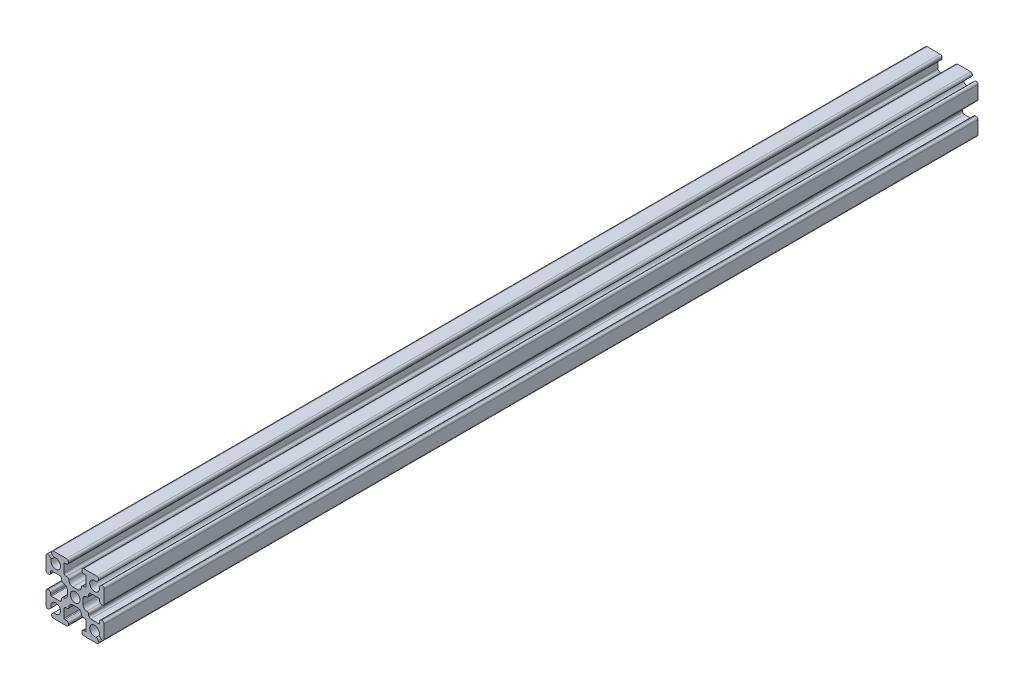
from build123d import *

# Parameters (mm, degrees)
SKETCH1_R           = 1.25
BOSS_EXTRUDE1_DEPTH = 225


with BuildPart() as part:
    # Sketch1 → Boss-Extrude1 (new body)
    with BuildSketch(Plane(origin=(0, 0, 0), x_dir=(-1, 0, 0), z_dir=(0, 0, -1))):
        with BuildLine():
            Line((6.646446609, 5.939339828), (6.163645978, 5.456539197))
            ThreePointArc((6.163645978, 5.456539197), (4.116116524, 4.116116524), (5.456539197, 6.163645978))
            Line((5.456539197, 6.163645978), (5.939339828, 6.646446609))
            ThreePointArc((5.939339828, 6.646446609), (6.047726204, 7.191341716), (5.585786438, 7.5))
            Line((5.585786438, 7.5), (2.25, 7.5))
            ThreePointArc((2.25, 7.5), (1.896446609, 7.353553391), (1.75, 7))
            Line((1.75, 7), (1.75, 6.8))
            ThreePointArc((1.75, 6.8), (1.896446609, 6.446446609), (2.25, 6.3))
            Line((2.25, 6.3), (2.65, 6.3))
            ThreePointArc((2.65, 6.3), (2.791421356, 6.241421356), (2.85, 6.1))
            Line((2.85, 6.1), (2.85, 4))
            ThreePointArc((2.85, 4), (2.703553391, 3.646446609), (2.35, 3.5))
            Line((2.35, 3.5), (2.1, 3.5))
            ThreePointArc((2.1, 3.5), (1.746446609, 3.353553391), (1.6, 3))
            ThreePointArc((1.6, 3), (1.307106781, 2.292893219), (0.6, 2))
            Line((0.6, 2), (-0.6, 2))
            ThreePointArc((-0.6, 2), (-1.307106781, 2.292893219), (-1.6, 3))
            ThreePointArc((-1.6, 3), (-1.746446609, 3.353553391), (-2.1, 3.5))
            Line((-2.1, 3.5), (-2.35, 3.5))
            ThreePointArc((-2.35, 3.5), (-2.703553391, 3.646446609), (-2.85, 4))
            Line((-2.85, 4), (-2.85, 6.1))
            ThreePointArc((-2.85, 6.1), (-2.791421356, 6.241421356), (-2.65, 6.3))
            Line((-2.65, 6.3), (-2.25, 6.3))
            ThreePointArc((-2.25, 6.3), (-1.896446609, 6.446446609), (-1.75, 6.8))
            Line((-1.75, 6.8), (-1.75, 7))
            ThreePointArc((-1.75, 7), (-1.896446609, 7.353553391), (-2.25, 7.5))
            Line((-2.25, 7.5), (-5.585786438, 7.5))
            ThreePointArc((-5.585786438, 7.5), (-6.047726204, 7.191341716), (-5.939339828, 6.646446609))
            Line((-5.939339828, 6.646446609), (-5.456539197, 6.163645978))
            ThreePointArc((-5.456539197, 6.163645978), (-4.116116524, 4.116116524), (-6.163645978, 5.456539197))
            Line((-6.163645978, 5.456539197), (-6.646446609, 5.939339828))
            ThreePointArc((-6.646446609, 5.939339828), (-7.191341716, 6.047726204), (-7.5, 5.585786438))
            Line((-7.5, 5.585786438), (-7.5, 2.25))
            ThreePointArc((-7.5, 2.25), (-7.353553391, 1.896446609), (-7, 1.75))
            Line((-7, 1.75), (-6.8, 1.75))
            ThreePointArc((-6.8, 1.75), (-6.446446609, 1.896446609), (-6.3, 2.25))
            Line((-6.3, 2.25), (-6.3, 2.65))
            ThreePointArc((-6.3, 2.65), (-6.241421356, 2.791421356), (-6.1, 2.85))
            Line((-6.1, 2.85), (-4, 2.85))
            ThreePointArc((-4, 2.85), (-3.646446609, 2.703553391), (-3.5, 2.35))
            Line((-3.5, 2.35), (-3.5, 2.1))
            ThreePointArc((-3.5, 2.1), (-3.353553391, 1.746446609), (-3, 1.6))
            ThreePointArc((-3, 1.6), (-2.292893219, 1.307106781), (-2, 0.6))
            Line((-2, 0.6), (-2, -0.6))
            ThreePointArc((-2, -0.6), (-2.292893219, -1.307106781), (-3, -1.6))
            ThreePointArc((-3, -1.6), (-3.353553391, -1.746446609), (-3.5, -2.1))
            Line((-3.5, -2.1), (-3.5, -2.35))
            ThreePointArc((-3.5, -2.35), (-3.646446609, -2.703553391), (-4, -2.85))
            Line((-4, -2.85), (-6.1, -2.85))
            ThreePointArc((-6.1, -2.85), (-6.241421356, -2.791421356), (-6.3, -2.65))
            Line((-6.3, -2.65), (-6.3, -2.25))
            ThreePointArc((-6.3, -2.25), (-6.446446609, -1.896446609), (-6.8, -1.75))
            Line((-6.8, -1.75), (-7, -1.75))
            ThreePointArc((-7, -1.75), (-7.353553391, -1.896446609), (-7.5, -2.25))
            Line((-7.5, -2.25), (-7.5, -5.585786438))
            ThreePointArc((-7.5, -5.585786438), (-7.191341716, -6.047726204), (-6.646446609, -5.939339828))
            Line((-6.646446609, -5.939339828), (-6.163645978, -5.456539197))
            ThreePointArc((-6.163645978, -5.456539197), (-4.116116524, -4.116116524), (-5.456539197, -6.163645978))
            Line((-5.456539197, -6.163645978), (-5.939339828, -6.646446609))
            ThreePointArc((-5.939339828, -6.646446609), (-6.047726204, -7.191341716), (-5.585786438, -7.5))
            Line((-5.585786438, -7.5), (-2.25, -7.5))
            ThreePointArc((-2.25, -7.5), (-1.896446609, -7.353553391), (-1.75, -7))
            Line((-1.75, -7), (-1.75, -6.8))
            ThreePointArc((-1.75, -6.8), (-1.896446609, -6.446446609), (-2.25, -6.3))
            Line((-2.25, -6.3), (-2.65, -6.3))
            ThreePointArc((-2.65, -6.3), (-2.791421356, -6.241421356), (-2.85, -6.1))
            Line((-2.85, -6.1), (-2.85, -4))
            ThreePointArc((-2.85, -4), (-2.703553391, -3.646446609), (-2.35, -3.5))
            Line((-2.35, -3.5), (-2.1, -3.5))
            ThreePointArc((-2.1, -3.5), (-1.746446609, -3.353553391), (-1.6, -3))
            ThreePointArc((-1.6, -3), (-1.307106781, -2.292893219), (-0.6, -2))
            Line((-0.6, -2), (0.6, -2))
            ThreePointArc((0.6, -2), (1.307106781, -2.292893219), (1.6, -3))
            ThreePointArc((1.6, -3), (1.746446609, -3.353553391), (2.1, -3.5))
            Line((2.1, -3.5), (2.35, -3.5))
            ThreePointArc((2.35, -3.5), (2.703553391, -3.646446609), (2.85, -4))
            Line((2.85, -4), (2.85, -6.1))
            ThreePointArc((2.85, -6.1), (2.791421356, -6.241421356), (2.65, -6.3))
            Line((2.65, -6.3), (2.25, -6.3))
            ThreePointArc((2.25, -6.3), (1.896446609, -6.446446609), (1.75, -6.8))
            Line((1.75, -6.8), (1.75, -7))
            ThreePointArc((1.75, -7), (1.896446609, -7.353553391), (2.25, -7.5))
            Line((2.25, -7.5), (5.585786438, -7.5))
            ThreePointArc((5.585786438, -7.5), (6.047726204, -7.191341716), (5.939339828, -6.646446609))
            Line((5.939339828, -6.646446609), (5.456539197, -6.163645978))
            ThreePointArc((5.456539197, -6.163645978), (4.116116524, -4.116116524), (6.163645978, -5.456539197))
            Line((6.163645978, -5.456539197), (6.646446609, -5.939339828))
            ThreePointArc((6.646446609, -5.939339828), (7.191341716, -6.047726204), (7.5, -5.585786438))
            Line((7.5, -5.585786438), (7.5, -2.25))
            ThreePointArc((7.5, -2.25), (7.353553391, -1.896446609), (7, -1.75))
            Line((7, -1.75), (6.8, -1.75))
            ThreePointArc((6.8, -1.75), (6.446446609, -1.896446609), (6.3, -2.25))
            Line((6.3, -2.25), (6.3, -2.65))
            ThreePointArc((6.3, -2.65), (6.241421356, -2.791421356), (6.1, -2.85))
            Line((6.1, -2.85), (4, -2.85))
            ThreePointArc((4, -2.85), (3.646446609, -2.703553391), (3.5, -2.35))
            Line((3.5, -2.35), (3.5, -2.1))
            ThreePointArc((3.5, -2.1), (3.353553391, -1.746446609), (3, -1.6))
            ThreePointArc((3, -1.6), (2.292893219, -1.307106781), (2, -0.6))
            Line((2, -0.6), (2, 0.6))
            ThreePointArc((2, 0.6), (2.292893219, 1.307106781), (3, 1.6))
            ThreePointArc((3, 1.6), (3.353553391, 1.746446609), (3.5, 2.1))
            Line((3.5, 2.1), (3.5, 2.35))
            ThreePointArc((3.5, 2.35), (3.646446609, 2.703553391), (4, 2.85))
            Line((4, 2.85), (6.1, 2.85))
            ThreePointArc((6.1, 2.85), (6.241421356, 2.791421356), (6.3, 2.65))
            Line((6.3, 2.65), (6.3, 2.25))
            ThreePointArc((6.3, 2.25), (6.446446609, 1.896446609), (6.8, 1.75))
            Line((6.8, 1.75), (7, 1.75))
            ThreePointArc((7, 1.75), (7.353553391, 1.896446609), (7.5, 2.25))
            Line((7.5, 2.25), (7.5, 5.585786438))
            ThreePointArc((7.5, 5.585786438), (7.191341716, 6.047726204), (6.646446609, 5.939339828))
        make_face()
        Circle(SKETCH1_R, mode=Mode.SUBTRACT)
    extrude(amount=-BOSS_EXTRUDE1_DEPTH)


solid = part.part
